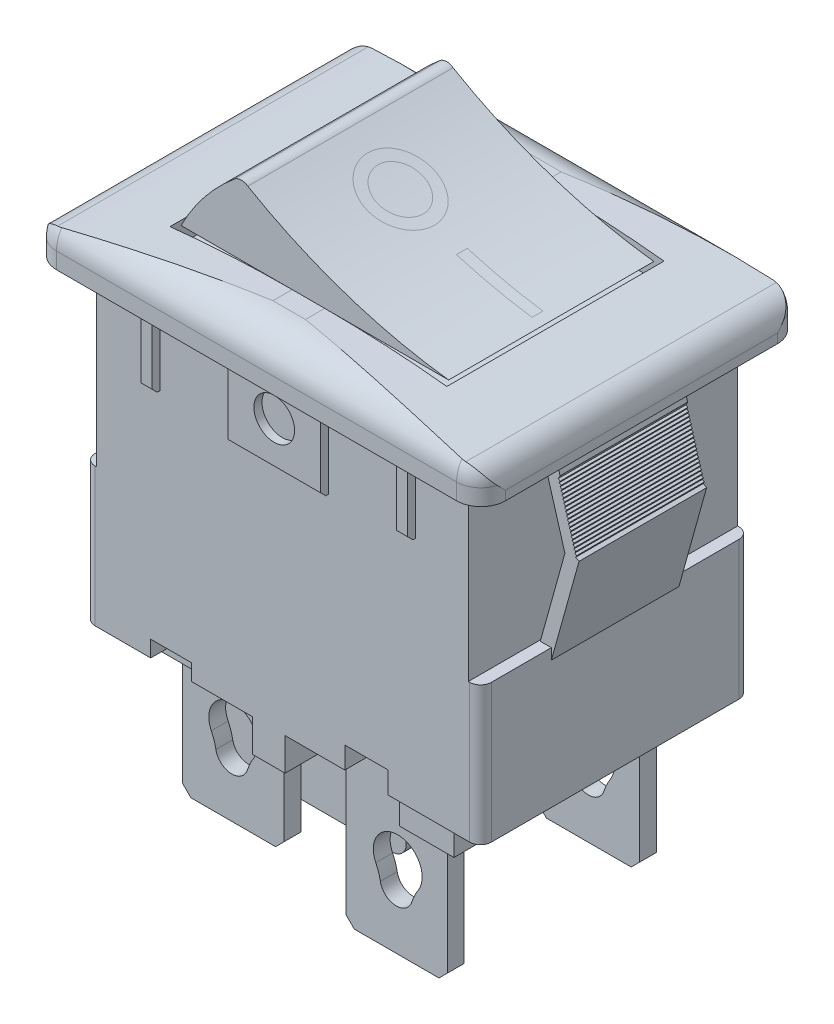
from build123d import *

# Parameters (mm, degrees)
SKETCH1_W                = 18.542
SKETCH1_H                = 14.732
EXTRUDE1_DEPTH           = 6.2992
SKETCH2_W                = 21.0058
SKETCH2_H                = 15.0114
EXTRUDE2_DEPTH           = 2.286
CUT_EXTRUDE5_DEPTH       = 8.89
FILLET1_R                = 1.524
FILLET2_R                = 1.143
SKETCH19_W               = 1.905
SKETCH19_H               = 0.762
CUT_EXTRUDE10_DEPTH      = 7.62
SKETCH20_W               = 2.54
SKETCH20_H               = 2.54
BOSS_EXTRUDE1_DEPTH      = 1.524
SKETCH21_W               = 2.032
SKETCH21_H               = 1.016
CUT_EXTRUDE11_DEPTH      = 1.905
SKETCH22_W               = 9.271
SKETCH22_H               = 1.016
BOSS_EXTRUDE2_DEPTH      = 8.763
FILLET3_R                = 0.635
SKETCH3_W                = 4.7498
SKETCH3_H                = 0.7874
EXTRUDE3_DEPTH           = 8.763
CHAMFER1_SIZE            = 0.762
CHAMFER2_SIZE            = 0.3683
CUT_EXTRUDE12_DEPTH      = 22.181395756
CHAMFER1_OF_MIRROR4_SIZE = 0.762
CHAMFER2_OF_MIRROR4_SIZE = 0.3683
SKETCH18_W               = 12.954
SKETCH18_H               = 10.16
CUT_EXTRUDE9_DEPTH       = 1.27
EXTRUDE4_DEPTH           = 4.8006
SKETCH10_W               = 0.508
SKETCH10_H               = 3.683
SKETCH10_W_2             = 4.318
SKETCH10_H_2             = 3.937
SKETCH10_R               = 0.9525
EXTRUDE7_DEPTH           = 0.381
CHAMFER4_SIZE            = 0.254
CHAMFER4_OF_MIRROR1_SIZE = 0.254
SKETCH17_W               = 0.5715
SKETCH17_H               = 8.255
CUT_EXTRUDE6_DEPTH       = 7.62
EXTRUDE9_DEPTH           = 2.9845
CUT_EXTRUDE3_DEPTH       = 22.396788431
LPATTERN4_COUNT          = 20
LPATTERN4_PITCH          = 0.1524
MIRROR2_COPY_1_DEPTH     = 22.396788431
MIRROR2_COPY_2_DEPTH     = 22.396788431
MIRROR2_COPY_3_DEPTH     = 22.396788431
MIRROR2_COPY_4_DEPTH     = 22.396788431
MIRROR2_COPY_5_DEPTH     = 22.396788431
MIRROR2_COPY_6_DEPTH     = 22.396788431
MIRROR2_COPY_7_DEPTH     = 22.396788431
MIRROR2_COPY_8_DEPTH     = 22.396788431
MIRROR2_COPY_9_DEPTH     = 22.396788431
MIRROR2_COPY_10_DEPTH    = 22.396788431
MIRROR2_COPY_11_DEPTH    = 22.396788431
MIRROR2_COPY_12_DEPTH    = 22.396788431
MIRROR2_COPY_13_DEPTH    = 22.396788431
MIRROR2_COPY_14_DEPTH    = 22.396788431
MIRROR2_COPY_15_DEPTH    = 22.396788431
MIRROR2_COPY_16_DEPTH    = 22.396788431
MIRROR2_COPY_17_DEPTH    = 22.396788431
MIRROR2_COPY_18_DEPTH    = 22.396788431
MIRROR2_COPY_19_DEPTH    = 22.396788431
FILLET4_R                = 0.508


with BuildPart() as part:
    # Sketch1 → Extrude1 (new, symmetric)
    with BuildSketch(Plane.XY):
        Rectangle(SKETCH1_W, SKETCH1_H)
    extrude(amount=EXTRUDE1_DEPTH, both=True)

    # Sketch2 → Extrude2 (add)
    with BuildSketch(Plane(origin=(0, 7.366, 0), x_dir=(-1, 0, 0), z_dir=(0, 1, 0))):
        Rectangle(SKETCH2_W, SKETCH2_H)
    extrude(amount=EXTRUDE2_DEPTH)

    # Sketch16 → Cut-Extrude5 (cut, symmetric)
    with BuildSketch(Plane.XY):
        with BuildLine():
            Line((10.5029, 9.652), (10.5029, 8.754755023))
            ThreePointArc((10.5029, 8.754755023), (5.652611148, 9.427215062), (0.761090302, 9.652))
            Line((0.761090302, 9.652), (10.5029, 9.652))
        make_face()
        with BuildLine():
            Line((-0.761090302, 9.652), (-10.5029, 9.652))
            Line((-10.5029, 9.652), (-10.5029, 8.754755023))
            ThreePointArc((-10.5029, 8.754755023), (-5.652611148, 9.427215062), (-0.761090302, 9.652))
        make_face()
    extrude(amount=CUT_EXTRUDE5_DEPTH, both=True, mode=Mode.SUBTRACT)

    # Fillet1
    # the kernel refuses this fillet: 1.524 mm, written as the material it takes off along each edge
    with BuildSketch(Plane(origin=(-19.811090302, 9.652, -7.5057), x_dir=(0, 0, 1), z_dir=(1, 0, 0))) as fillet1_piece_1:
        with BuildLine():
            CenterArc((FILLET1_R, FILLET1_R), FILLET1_R, 180, 90)
            Line((0, FILLET1_R), (0, 0))
            Line((0, 0), (FILLET1_R, 0))
        make_face()
    extrude(amount=39.622180604, mode=Mode.SUBTRACT)
    with BuildSketch(Plane(origin=(19.811090302, 9.652, 7.5057), x_dir=(0, -1, 0), z_dir=(-1, 0, 0))) as fillet1_piece_2:
        with BuildLine():
            CenterArc((FILLET1_R, -FILLET1_R), FILLET1_R, 90, 90)
            Line((0, -FILLET1_R), (0, 0))
            Line((0, 0), (FILLET1_R, 0))
        make_face()
    extrude(amount=39.622180604, mode=Mode.SUBTRACT)

    # Fillet2
    # the kernel refuses this fillet: 1.143 mm, written as the material it takes off along each edge
    with BuildSketch(Plane(origin=(-10.5029, 4.5085, -7.5057), x_dir=(0, 0, 1), z_dir=(0, 1, 0)), Plane(origin=(-10.5029, 4.5085, 7.5057), x_dir=(1, 0, 0), z_dir=(0, 1, 0))) as fillet2_piece_1:
        with BuildLine():
            CenterArc((FILLET2_R, FILLET2_R), FILLET2_R, 180, 90)
            Line((0, FILLET2_R), (0, 0))
            Line((0, 0), (FILLET2_R, 0))
        make_face()
    extrude(amount=3.6195, mode=Mode.SUBTRACT)
    with BuildSketch(Plane(origin=(10.5029, 4.5085, -7.5057), x_dir=(0, 0, 1), z_dir=(0, 1, 0)), Plane(origin=(10.5029, 4.5085, 7.5057), x_dir=(-1, 0, 0), z_dir=(0, 1, 0))) as fillet2_piece_2:
        with BuildLine():
            CenterArc((FILLET2_R, -FILLET2_R), FILLET2_R, 90, 90)
            Line((0, -FILLET2_R), (0, 0))
            Line((0, 0), (FILLET2_R, 0))
        make_face()
    extrude(amount=3.6195, mode=Mode.SUBTRACT)
    with BuildSketch(Plane(origin=(-10.5029, 8.754755023, 9.794413815), x_dir=(0, -1, 0), z_dir=(0, 0, -1)), Plane(origin=(10.5029, 8.754755023, -9.794413815), x_dir=(0, -1, 0), z_dir=(0, 0, 1))) as fillet2_piece_3:
        with BuildLine():
            CenterArc((0.958979121, -1.143), FILLET2_R, 90, 80.516966091)
            ThreePointArc((-0.168401134, -0.954684411), (-0.086369696, -0.476959583), (0, 0))
            Line((0, 0), (0.958979121, 0))
        make_face()
    extrude(amount=19.588827631, mode=Mode.SUBTRACT)
    with BuildSketch(Plane(origin=(-10.5029, 8.128, 5.9817), x_dir=(0, 0.7464463110024604, -0.6654456437537316), z_dir=(0, -0.6654456437537316, -0.7464463110024604))) as fillet2_piece_4:
        with BuildLine():
            CenterArc((1.524 - FILLET2_R, FILLET2_R), FILLET2_R, 270, 90)
            Line((1.524, FILLET2_R), (1.524, 0))
            Line((1.524, 0), (1.524 - FILLET2_R, 0))
        make_face()
    revolve(axis=Axis((-10.5029, 8.128, 5.9817), (1, 0, 0)), revolution_arc=131.716523052, mode=Mode.SUBTRACT)
    with BuildSketch(Plane(origin=(10.5029, 8.128, 5.9817), x_dir=(0, 0.7464463110024582, -0.665445643753734), z_dir=(0, -0.665445643753734, -0.7464463110024582))) as fillet2_piece_5:
        with BuildLine():
            CenterArc((1.524 - FILLET2_R, -FILLET2_R), FILLET2_R, 0, 90)
            Line((1.524 - FILLET2_R, 0), (1.524, 0))
            Line((1.524, 0), (1.524, -FILLET2_R))
        make_face()
    revolve(axis=Axis((10.5029, 8.128, 5.9817), (1, 0, 0)), revolution_arc=131.716523052, mode=Mode.SUBTRACT)
    with BuildSketch(Plane(origin=(10.5029, 8.128, -5.9817), x_dir=(0, 0.7464463110024628, 0.6654456437537288), z_dir=(0, -0.6654456437537288, 0.7464463110024628))) as fillet2_piece_6:
        with BuildLine():
            CenterArc((1.524 - FILLET2_R, FILLET2_R), FILLET2_R, 270, 90)
            Line((1.524, FILLET2_R), (1.524, 0))
            Line((1.524, 0), (1.524 - FILLET2_R, 0))
        make_face()
    revolve(axis=Axis((10.5029, 8.128, -5.9817), (-1, 0, 0)), revolution_arc=131.716523052, mode=Mode.SUBTRACT)
    with BuildSketch(Plane(origin=(-10.5029, 8.128, -5.9817), x_dir=(0, 0.7464463110024571, 0.6654456437537352), z_dir=(0, -0.6654456437537352, 0.7464463110024571))) as fillet2_piece_7:
        with BuildLine():
            CenterArc((1.524 - FILLET2_R, -FILLET2_R), FILLET2_R, 0, 90)
            Line((1.524, -FILLET2_R), (1.524, 0))
            Line((1.524, 0), (1.524 - FILLET2_R, 0))
        make_face()
    revolve(axis=Axis((-10.5029, 8.128, -5.9817), (-1, 0, 0)), revolution_arc=131.716523052, mode=Mode.SUBTRACT)

    # Sketch19 → Cut-Extrude10 (cut, symmetric)
    with BuildSketch(Plane.XY):
        with Locations((-5.207, -6.985)):
            Rectangle(SKETCH19_W, SKETCH19_H)
    extrude(amount=CUT_EXTRUDE10_DEPTH, both=True, mode=Mode.SUBTRACT)

    # Sketch20 → Boss-Extrude1 (add)
    with BuildSketch(Plane.XZ.offset(7.366)):
        with Locations((-7.4295, 2.9972)):
            Rectangle(SKETCH20_W, SKETCH20_H)
        Polygon((-4.2545, 4.2672), (-4.2545, 1.7272), (0.127, 1.7272), (0.127, 6.2992), (-1.397, 6.2992), (-1.397, 4.2672), align=None)
        with Locations((6.223, 4.4958)):
            Rectangle(SKETCH20_W, SKETCH20_H)
    boss_extrude1 = extrude(amount=BOSS_EXTRUDE1_DEPTH)

    # Sketch21 → Cut-Extrude11 (cut)
    with BuildSketch(Plane.XY.offset(6.2992)):
        with Locations((3.937, -6.858)):
            Rectangle(SKETCH21_W, SKETCH21_H)
    cut_extrude11 = extrude(amount=-CUT_EXTRUDE11_DEPTH, mode=Mode.SUBTRACT)

    # Sketch22 → Boss-Extrude2 (add)
    with BuildSketch(Plane.XZ.offset(6.604)):
        with Locations((-4.6355, 0)):
            Rectangle(SKETCH22_W, SKETCH22_H)
    extrude(amount=BOSS_EXTRUDE2_DEPTH)

    # Fillet3
    fillet3_edges = [part.edges().sort_by_distance(p)[0] for p in [
        (-9.271, -15.367, 0),
        (0, -15.367, 0),
    ]]
    fillet(fillet3_edges, radius=FILLET3_R)

    # Mirror3: Boss-Extrude1, Cut-Extrude11 across plane
    add(boss_extrude1.mirror(Plane.XY))
    add(cut_extrude11.mirror(Plane.XY), mode=Mode.SUBTRACT)

    # Sketch3 → Extrude3 (add)
    with BuildSketch(Plane.XZ.offset(6.604)):
        with Locations((-5.207, 2.9972)):
            Rectangle(SKETCH3_W, SKETCH3_H)
        with Locations((3.937, 4.4958)):
            Rectangle(SKETCH3_W, SKETCH3_H)
    extrude3 = extrude(amount=EXTRUDE3_DEPTH)

    # Chamfer1
    chamfer1_edges = [part.edges().sort_by_distance(p)[0] for p in [
        (-7.5819, -15.367, 2.9972),
        (-2.8321, -15.367, 2.9972),
        (1.5621, -15.367, 4.4958),
        (6.3119, -15.367, 4.4958),
    ]]
    chamfer(chamfer1_edges, length=CHAMFER1_SIZE)

    # Chamfer2
    chamfer2_edges = [part.edges().sort_by_distance(p)[0] for p in [
        (3.937, -15.367, 4.8895),
        (3.937, -15.367, 4.1021),
        (-5.207, -15.367, 3.3909),
        (-5.207, -15.367, 2.6035),
    ]]
    chamfer(chamfer2_edges, length=CHAMFER2_SIZE)

    # Sketch23 → Cut-Extrude12 (cut, through all)
    with BuildSketch(Plane.XY.offset(2.6035)):
        with BuildLine():
            ThreePointArc((-4.249774745, -11.927634942), (-5.136162278, -10.162197205), (-6.234146972, -11.804416092))
            ThreePointArc((-6.234146972, -11.804416092), (-6.104584573, -12.122860382), (-6.019212003, -12.455883963))
            ThreePointArc((-6.019212003, -12.455883963), (-5.317192012, -13.077582126), (-4.543653167, -12.547508236))
            ThreePointArc((-4.543653167, -12.547508236), (-4.417737322, -12.22760453), (-4.249774745, -11.927634942))
        make_face()
        with BuildLine():
            ThreePointArc((4.945025255, -11.927634942), (4.058637722, -10.162197205), (2.960653028, -11.804416092))
            ThreePointArc((2.960653028, -11.804416092), (3.090215427, -12.122860382), (3.175587997, -12.455883963))
            ThreePointArc((3.175587997, -12.455883963), (3.877607988, -13.077582126), (4.651146833, -12.547508236))
            ThreePointArc((4.651146833, -12.547508236), (4.777062678, -12.22760453), (4.945025255, -11.927634942))
        make_face()
    cut_extrude12 = extrude(amount=CUT_EXTRUDE12_DEPTH, mode=Mode.SUBTRACT)

    # Mirror4: Extrude3, Cut-Extrude12 across plane
    add(extrude3.mirror(Plane.XY))
    add(cut_extrude12.mirror(Plane.XY), mode=Mode.SUBTRACT)

    # Chamfer1 of Mirror4
    chamfer1_of_mirror4_edges = [part.edges().sort_by_distance(p)[0] for p in [
        (-7.5819, -15.367, -2.9972),
        (-2.8321, -15.367, -2.9972),
        (1.5621, -15.367, -4.4958),
        (6.3119, -15.367, -4.4958),
    ]]
    chamfer(chamfer1_of_mirror4_edges, length=CHAMFER1_OF_MIRROR4_SIZE)

    # Chamfer2 of Mirror4
    chamfer2_of_mirror4_edges = [part.edges().sort_by_distance(p)[0] for p in [
        (3.937, -15.367, -4.8895),
        (3.937, -15.367, -4.1021),
        (-5.207, -15.367, -3.3909),
        (-5.207, -15.367, -2.6035),
    ]]
    chamfer(chamfer2_of_mirror4_edges, length=CHAMFER2_OF_MIRROR4_SIZE)

    # Sketch18 → Cut-Extrude9 (cut)
    with BuildSketch(Plane(origin=(0, 9.652, 0), x_dir=(1, 0, 0), z_dir=(0, 1, 0))):
        Rectangle(SKETCH18_W, SKETCH18_H)
    extrude(amount=-CUT_EXTRUDE9_DEPTH, mode=Mode.SUBTRACT)

    # Sketch10 → Extrude7 (add)
    # profile 1 of 3: a face of its own
    with BuildSketch(Plane.XY.offset(6.2992)):
        with Locations((5.9817, 5.5245)):
            Rectangle(SKETCH10_W, SKETCH10_H)
    # profile 2 of 3: a face of its own
    with BuildSketch(Plane.XY.offset(6.2992)):
        with Locations((-5.9817, 5.5245)):
            Rectangle(SKETCH10_W, SKETCH10_H)
    # profile 3 of 3: a face of its own
    with BuildSketch(Plane.XY.offset(6.2992)):
        with Locations((0, 5.3975)):
            Rectangle(SKETCH10_W_2, SKETCH10_H_2)
        with Locations(Location((0, 5.594582468, 0), (0, 0, 180))):
            Circle(SKETCH10_R, mode=Mode.SUBTRACT)
    extrude7 = extrude(amount=EXTRUDE7_DEPTH)

    # Chamfer4
    chamfer4_edges = [part.edges().sort_by_distance(p)[0] for p in [
        (0, 3.429, 6.6802),
        (5.9817, 3.683, 6.6802),
        (-5.9817, 3.683, 6.6802),
    ]]
    chamfer(chamfer4_edges, length=CHAMFER4_SIZE)

    # Mirror1: Extrude7 across plane
    add(extrude7.mirror(Plane.XY))

    # Chamfer4 of Mirror1
    chamfer4_of_mirror1_edges = [part.edges().sort_by_distance(p)[0] for p in [
        (0, 3.429, -6.6802),
        (5.9817, 3.683, -6.6802),
        (-5.9817, 3.683, -6.6802),
    ]]
    chamfer(chamfer4_of_mirror1_edges, length=CHAMFER4_OF_MIRROR1_SIZE)

    # Sketch17 → Cut-Extrude6 (cut, symmetric)
    with BuildSketch(Plane.XY):
        with Locations((-8.98525, 3.2385)):
            Rectangle(SKETCH17_W, SKETCH17_H)
        with Locations((8.98525, 3.2385)):
            Rectangle(SKETCH17_W, SKETCH17_H)
    extrude(amount=CUT_EXTRUDE6_DEPTH, both=True, mode=Mode.SUBTRACT)

    # Sketch12 → Extrude9 (add, symmetric)
    with BuildSketch(Plane.XY):
        Polygon((8.659235665, -1.226796008), (9.905270333, 3.25182732), (8.698130845, 7.366), (9.3599, 7.366), (10.565678778, 3.256464891), (9.271, -1.397), align=None)
        Polygon((-9.271, -1.397), (-8.659235665, -1.226796008), (-9.905270333, 3.25182732), (-8.698130845, 7.366), (-9.3599, 7.366), (-10.565678778, 3.256464891), align=None)
    extrude(amount=EXTRUDE9_DEPTH, both=True)

    # Sketch13 → Cut-Extrude3 (cut, through all)
    with BuildSketch(Plane.XY.offset(2.9845)):
        Polygon((10.565678778, 3.256464891), (10.494167282, 3.500190363), (10.408060294, 3.342571879), align=None)
    cut_extrude3 = extrude(amount=-CUT_EXTRUDE3_DEPTH, mode=Mode.SUBTRACT)

    # LPattern4: Cut-Extrude3 ×20
    with Locations(*[Vector(-0.28154132180570673, 0.959549104588137, 0) * (i * LPATTERN4_PITCH) for i in range(1, LPATTERN4_COUNT)]):
        add(cut_extrude3, mode=Mode.SUBTRACT)

    # Mirror2: Cut-Extrude3 across plane
    add(cut_extrude3.mirror(Plane(origin=(0, 0, 0), x_dir=(0, 0, 1), z_dir=(1, 0, 0))), mode=Mode.SUBTRACT)

    # Mirror2 copy 1 sketch → Mirror2 copy 1 (cut, through all)
    with BuildSketch(Plane(origin=(0.042906897, 0.146235284, 2.9845), x_dir=(-1, 0, 0), z_dir=(0, 0, 1))):
        Polygon((10.565678778, -3.256464891), (10.494167282, -3.500190363), (10.408060294, -3.342571879), align=None)
    extrude(amount=-MIRROR2_COPY_1_DEPTH, mode=Mode.SUBTRACT)

    # Mirror2 copy 2 sketch → Mirror2 copy 2 (cut, through all)
    with BuildSketch(Plane(origin=(0.085813795, 0.292470567, 2.9845), x_dir=(-1, 0, 0), z_dir=(0, 0, 1))):
        Polygon((10.565678778, -3.256464891), (10.494167282, -3.500190363), (10.408060294, -3.342571879), align=None)
    extrude(amount=-MIRROR2_COPY_2_DEPTH, mode=Mode.SUBTRACT)

    # Mirror2 copy 3 sketch → Mirror2 copy 3 (cut, through all)
    with BuildSketch(Plane(origin=(0.128720692, 0.438705851, 2.9845), x_dir=(-1, 0, 0), z_dir=(0, 0, 1))):
        Polygon((10.565678778, -3.256464891), (10.494167282, -3.500190363), (10.408060294, -3.342571879), align=None)
    extrude(amount=-MIRROR2_COPY_3_DEPTH, mode=Mode.SUBTRACT)

    # Mirror2 copy 4 sketch → Mirror2 copy 4 (cut, through all)
    with BuildSketch(Plane(origin=(0.17162759, 0.584941134, 2.9845), x_dir=(-1, 0, 0), z_dir=(0, 0, 1))):
        Polygon((10.565678778, -3.256464891), (10.494167282, -3.500190363), (10.408060294, -3.342571879), align=None)
    extrude(amount=-MIRROR2_COPY_4_DEPTH, mode=Mode.SUBTRACT)

    # Mirror2 copy 5 sketch → Mirror2 copy 5 (cut, through all)
    with BuildSketch(Plane(origin=(0.214534487, 0.731176418, 2.9845), x_dir=(-1, 0, 0), z_dir=(0, 0, 1))):
        Polygon((10.565678778, -3.256464891), (10.494167282, -3.500190363), (10.408060294, -3.342571879), align=None)
    extrude(amount=-MIRROR2_COPY_5_DEPTH, mode=Mode.SUBTRACT)

    # Mirror2 copy 6 sketch → Mirror2 copy 6 (cut, through all)
    with BuildSketch(Plane(origin=(0.257441385, 0.877411701, 2.9845), x_dir=(-1, 0, 0), z_dir=(0, 0, 1))):
        Polygon((10.565678778, -3.256464891), (10.494167282, -3.500190363), (10.408060294, -3.342571879), align=None)
    extrude(amount=-MIRROR2_COPY_6_DEPTH, mode=Mode.SUBTRACT)

    # Mirror2 copy 7 sketch → Mirror2 copy 7 (cut, through all)
    with BuildSketch(Plane(origin=(0.300348282, 1.023646985, 2.9845), x_dir=(-1, 0, 0), z_dir=(0, 0, 1))):
        Polygon((10.565678778, -3.256464891), (10.494167282, -3.500190363), (10.408060294, -3.342571879), align=None)
    extrude(amount=-MIRROR2_COPY_7_DEPTH, mode=Mode.SUBTRACT)

    # Mirror2 copy 8 sketch → Mirror2 copy 8 (cut, through all)
    with BuildSketch(Plane(origin=(0.34325518, 1.169882268, 2.9845), x_dir=(-1, 0, 0), z_dir=(0, 0, 1))):
        Polygon((10.565678778, -3.256464891), (10.494167282, -3.500190363), (10.408060294, -3.342571879), align=None)
    extrude(amount=-MIRROR2_COPY_8_DEPTH, mode=Mode.SUBTRACT)

    # Mirror2 copy 9 sketch → Mirror2 copy 9 (cut, through all)
    with BuildSketch(Plane(origin=(0.386162077, 1.316117552, 2.9845), x_dir=(-1, 0, 0), z_dir=(0, 0, 1))):
        Polygon((10.565678778, -3.256464891), (10.494167282, -3.500190363), (10.408060294, -3.342571879), align=None)
    extrude(amount=-MIRROR2_COPY_9_DEPTH, mode=Mode.SUBTRACT)

    # Mirror2 copy 10 sketch → Mirror2 copy 10 (cut, through all)
    with BuildSketch(Plane(origin=(0.429068974, 1.462352835, 2.9845), x_dir=(-1, 0, 0), z_dir=(0, 0, 1))):
        Polygon((10.565678778, -3.256464891), (10.494167282, -3.500190363), (10.408060294, -3.342571879), align=None)
    extrude(amount=-MIRROR2_COPY_10_DEPTH, mode=Mode.SUBTRACT)

    # Mirror2 copy 11 sketch → Mirror2 copy 11 (cut, through all)
    with BuildSketch(Plane(origin=(0.471975872, 1.608588119, 2.9845), x_dir=(-1, 0, 0), z_dir=(0, 0, 1))):
        Polygon((10.565678778, -3.256464891), (10.494167282, -3.500190363), (10.408060294, -3.342571879), align=None)
    extrude(amount=-MIRROR2_COPY_11_DEPTH, mode=Mode.SUBTRACT)

    # Mirror2 copy 12 sketch → Mirror2 copy 12 (cut, through all)
    with BuildSketch(Plane(origin=(0.514882769, 1.754823402, 2.9845), x_dir=(-1, 0, 0), z_dir=(0, 0, 1))):
        Polygon((10.565678778, -3.256464891), (10.494167282, -3.500190363), (10.408060294, -3.342571879), align=None)
    extrude(amount=-MIRROR2_COPY_12_DEPTH, mode=Mode.SUBTRACT)

    # Mirror2 copy 13 sketch → Mirror2 copy 13 (cut, through all)
    with BuildSketch(Plane(origin=(0.557789667, 1.901058686, 2.9845), x_dir=(-1, 0, 0), z_dir=(0, 0, 1))):
        Polygon((10.565678778, -3.256464891), (10.494167282, -3.500190363), (10.408060294, -3.342571879), align=None)
    extrude(amount=-MIRROR2_COPY_13_DEPTH, mode=Mode.SUBTRACT)

    # Mirror2 copy 14 sketch → Mirror2 copy 14 (cut, through all)
    with BuildSketch(Plane(origin=(0.600696564, 2.04729397, 2.9845), x_dir=(-1, 0, 0), z_dir=(0, 0, 1))):
        Polygon((10.565678778, -3.256464891), (10.494167282, -3.500190363), (10.408060294, -3.342571879), align=None)
    extrude(amount=-MIRROR2_COPY_14_DEPTH, mode=Mode.SUBTRACT)

    # Mirror2 copy 15 sketch → Mirror2 copy 15 (cut, through all)
    with BuildSketch(Plane(origin=(0.643603462, 2.193529253, 2.9845), x_dir=(-1, 0, 0), z_dir=(0, 0, 1))):
        Polygon((10.565678778, -3.256464891), (10.494167282, -3.500190363), (10.408060294, -3.342571879), align=None)
    extrude(amount=-MIRROR2_COPY_15_DEPTH, mode=Mode.SUBTRACT)

    # Mirror2 copy 16 sketch → Mirror2 copy 16 (cut, through all)
    with BuildSketch(Plane(origin=(0.686510359, 2.339764537, 2.9845), x_dir=(-1, 0, 0), z_dir=(0, 0, 1))):
        Polygon((10.565678778, -3.256464891), (10.494167282, -3.500190363), (10.408060294, -3.342571879), align=None)
    extrude(amount=-MIRROR2_COPY_16_DEPTH, mode=Mode.SUBTRACT)

    # Mirror2 copy 17 sketch → Mirror2 copy 17 (cut, through all)
    with BuildSketch(Plane(origin=(0.729417257, 2.48599982, 2.9845), x_dir=(-1, 0, 0), z_dir=(0, 0, 1))):
        Polygon((10.565678778, -3.256464891), (10.494167282, -3.500190363), (10.408060294, -3.342571879), align=None)
    extrude(amount=-MIRROR2_COPY_17_DEPTH, mode=Mode.SUBTRACT)

    # Mirror2 copy 18 sketch → Mirror2 copy 18 (cut, through all)
    with BuildSketch(Plane(origin=(0.772324154, 2.632235104, 2.9845), x_dir=(-1, 0, 0), z_dir=(0, 0, 1))):
        Polygon((10.565678778, -3.256464891), (10.494167282, -3.500190363), (10.408060294, -3.342571879), align=None)
    extrude(amount=-MIRROR2_COPY_18_DEPTH, mode=Mode.SUBTRACT)

    # Mirror2 copy 19 sketch → Mirror2 copy 19 (cut, through all)
    with BuildSketch(Plane(origin=(0.815231051, 2.778470387, 2.9845), x_dir=(-1, 0, 0), z_dir=(0, 0, 1))):
        Polygon((10.565678778, -3.256464891), (10.494167282, -3.500190363), (10.408060294, -3.342571879), align=None)
    extrude(amount=-MIRROR2_COPY_19_DEPTH, mode=Mode.SUBTRACT)

    # Fillet4
    fillet4_edges = [part.edges().sort_by_distance(p)[0] for p in [
        (9.271, -4.1275, 6.2992),
        (9.271, -4.1275, -6.2992),
        (-9.271, -4.1275, 6.2992),
        (-9.271, -4.1275, -6.2992),
    ]]
    fillet(fillet4_edges, radius=FILLET4_R)


with BuildPart() as body_2:
    # Sketch6 → Extrude4 (new, symmetric)
    with BuildSketch(Plane.XY):
        with BuildLine():
            Line((-6.242182457, 9.369610405), (6.279065913, 9.369610405))
            ThreePointArc((6.279065913, 9.369610405), (1.422164045, 10.467942296), (-3.113381524, 12.523338871))
            ThreePointArc((-3.113381524, 12.523338871), (-3.429211695, 12.620538657), (-3.738011907, 12.502899698))
            ThreePointArc((-3.738011907, 12.502899698), (-5.148300738, 11.062693643), (-6.242182457, 9.369610405))
        make_face()
    extrude(amount=EXTRUDE4_DEPTH, both=True)


solid = Compound([part.part, body_2.part])
